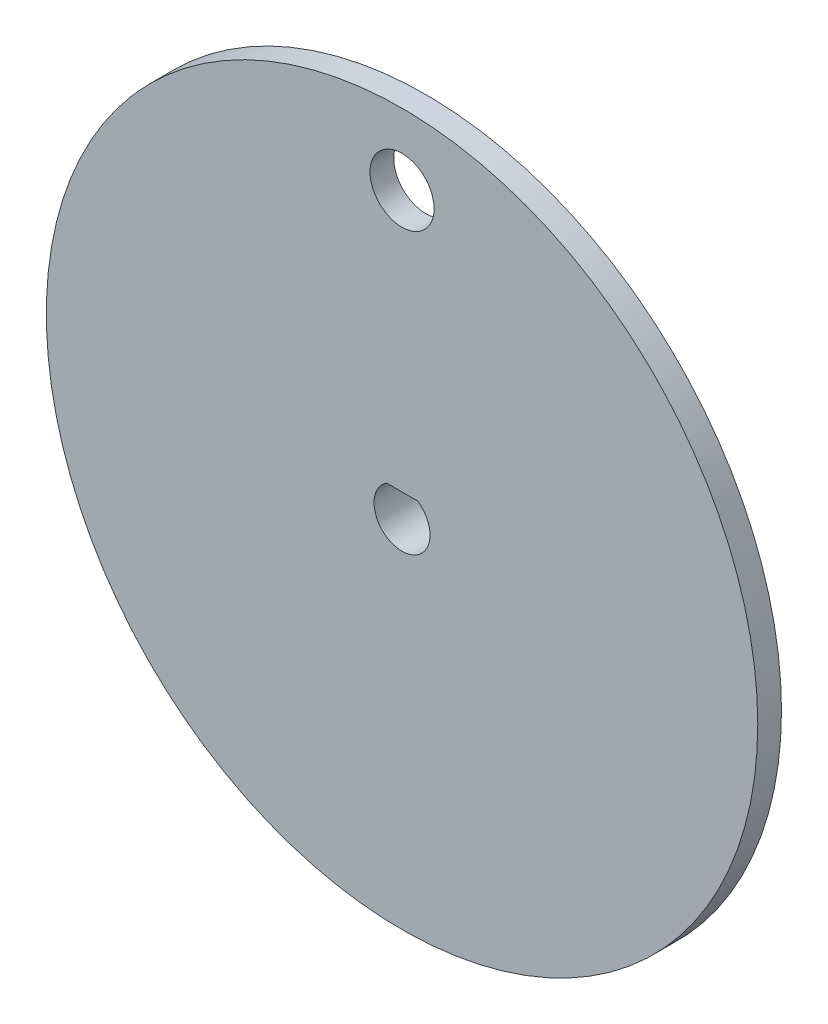
from build123d import *

# Parameters (mm, degrees)
SKETCH1_R           = 38.1
BOSS_EXTRUDE1_DEPTH = 2.54
SKETCH3_R           = 6.35
BOSS_EXTRUDE3_DEPTH = 19.05
SKETCH2_R           = 3.429
CUT_EXTRUDE1_DEPTH  = 59.046086001
CUT_EXTRUDE2_DEPTH  = 59.046086001


with BuildPart() as part:
    # Sketch1 → Boss-Extrude1 (new body)
    with BuildSketch(Plane.XY):
        Circle(SKETCH1_R)
    extrude(amount=BOSS_EXTRUDE1_DEPTH)

    # Sketch3 → Boss-Extrude3 (add)
    with BuildSketch(Plane(origin=(0, 0, 0), x_dir=(-1, 0, 0), z_dir=(0, 0, -1))):
        Circle(SKETCH3_R)
    extrude(amount=BOSS_EXTRUDE3_DEPTH)

    # Sketch2 → Cut-Extrude1 (cut, through all)
    with BuildSketch(Plane.XY.offset(2.54)):
        with Locations((0, 30.48)):
            Circle(SKETCH2_R)
    extrude(amount=-CUT_EXTRUDE1_DEPTH, mode=Mode.SUBTRACT)

    # Sketch4 → Cut-Extrude2 (cut, through all)
    with BuildSketch(Plane(origin=(0, 0, -19.05), x_dir=(-1, 0, 0), z_dir=(0, 0, -1))):
        with BuildLine():
            Line((-1.658312395, 2.5), (1.658312395, 2.5))
            ThreePointArc((1.658312395, 2.5), (0, -3), (-1.658312395, 2.5))
        make_face()
    extrude(amount=-CUT_EXTRUDE2_DEPTH, mode=Mode.SUBTRACT)


solid = part.part
